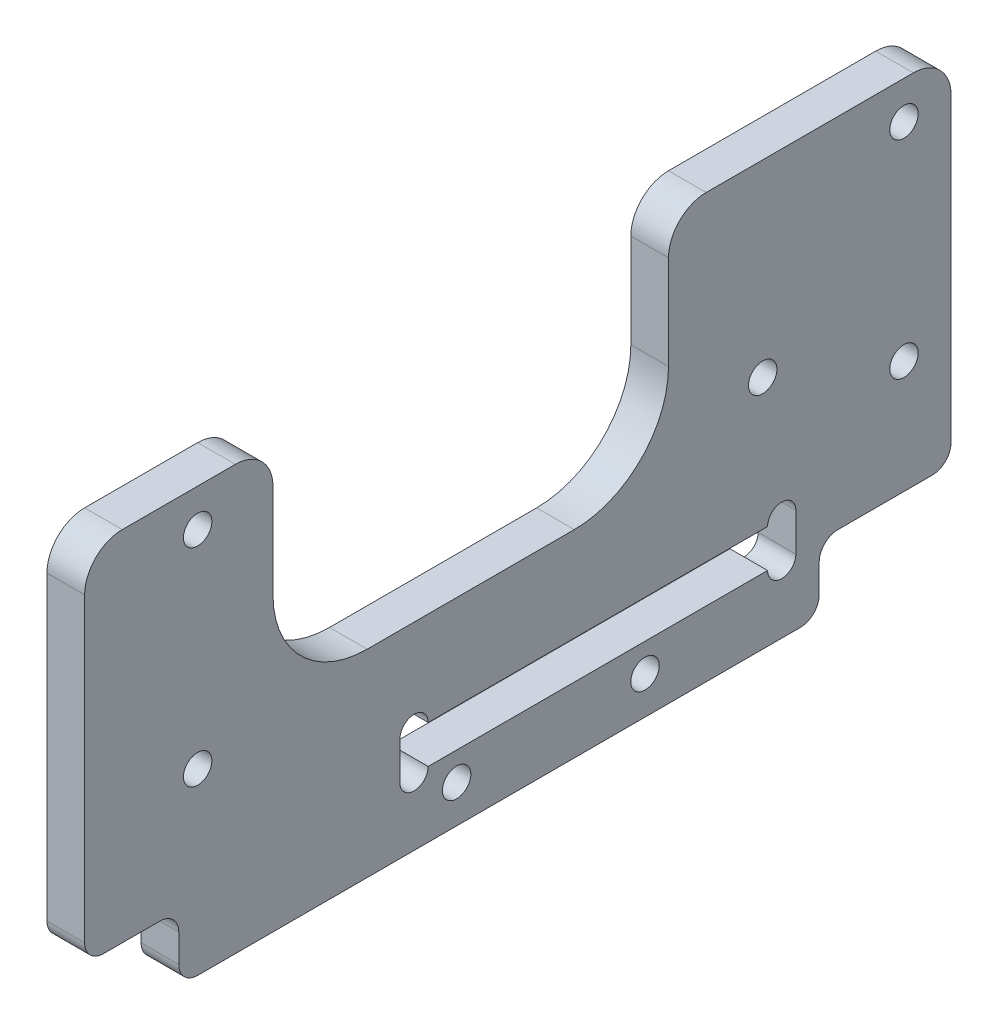
from build123d import *

# Parameters (mm, degrees)
SKETCH_1_W              = 85
SKETCH_1_H              = 40
EXTRUDE_1_DEPTH         = 4
SKETCH_2_R              = 1.51
CUT_EXTRUDE_1_DEPTH     = 10
SKETCH_3_R              = 1.51
CUT_EXTRUDE_2_DEPTH     = 10
SKETCH_5_R              = 1.51
CUT_EXTRUDE_4_DEPTH     = 10
SKETCH_6_W              = 85
SKETCH_6_H              = 25
EXTRUDE_2_DEPTH         = 4
SKETCH_7_R              = 1.51
CUT_EXTRUDE_5_DEPTH     = 3
CUT_EXTRUDE_START       = -3
SKETCH_8_R              = 1.51
CUT_EXTRUDE_6_DEPTH     = 3
CUT_EXTRUDE_7_DEPTH     = 10
SKETCH_10_R             = 1.5
CUT_EXTRUDE_8_DEPTH     = 10
SKETCH_12_OUTSIDE_W     = 108.416
SKETCH_12_OUTSIDE_H     = 88.416
CUT_EXTRUDE_9_DEPTH     = 10
SKETCH_13_W             = 85
SKETCH_13_H             = 20
CUT_EXTRUDE_10_DEPTH    = 10
FILLET_2_R              = 4
MOVE_FACE_1_DEPTH       = 4
MOVE_FACE_2_OUTLINE_R   = 1.51
MOVE_FACE_2_DEPTH       = 4
MOVE_FACE_2_2_OUTLINE_R = 1.51
MOVE_FACE_2_2_DEPTH     = 4
MOVE_FACE_3_OUTLINE_R   = 1.51
MOVE_FACE_3_DEPTH       = 4
MOVE_FACE_3_2_OUTLINE_R = 1.51
MOVE_FACE_3_2_DEPTH     = 4
CUT_EXTRUDE_11_DEPTH    = 10
FILLET_3_R              = 2
CUT_EXTRUDE_12_DEPTH    = 10
FILLET_4_R              = 2


# Read off the part's stored shape, not the designer's step: 移动面1, 移动面2, 移动面3
with BuildPart() as part:
    # 草图1 → 凸台-拉伸1 (new body)
    with BuildSketch(Plane(origin=(0, 0, 0), x_dir=(0, 0, -1), z_dir=(1, 0, 0))):
        Rectangle(SKETCH_1_W, SKETCH_1_H)
    extrude(amount=EXTRUDE_1_DEPTH)

    # 草图2 → 切除-拉伸1 (cut)
    with BuildSketch(Plane.ZY):
        with Locations((-37.5, -11)):
            Circle(SKETCH_2_R)
        with Locations((37.5, -11)):
            Circle(SKETCH_2_R)
        with Locations((37.5, 11)):
            Circle(SKETCH_2_R)
        with Locations((-37.5, 11)):
            Circle(SKETCH_2_R)
    extrude(amount=-CUT_EXTRUDE_1_DEPTH, mode=Mode.SUBTRACT)

    # 草图3 → 切除-拉伸2 (cut)
    with BuildSketch(Plane.ZY):
        with Locations((-2.5, 0)):
            Circle(SKETCH_3_R)
        with Locations((-22.5, 0)):
            Circle(SKETCH_3_R)
    extrude(amount=-CUT_EXTRUDE_2_DEPTH, mode=Mode.SUBTRACT)

    # 草图5 → 切除-拉伸4 (cut)
    with BuildSketch(Plane.ZY):
        with BuildLine():
            Line((29.5, 6), (29.5, 20))
            Line((29.5, 20), (-12.5, 20))
            Line((-12.5, 20), (-12.5, 6))
            ThreePointArc((-12.5, 6), (-9.571067812, -1.071067812), (-2.5, -4))
            Line((-2.5, -4), (19.5, -4))
            ThreePointArc((19.5, -4), (26.571067812, -1.071067812), (29.5, 6))
        make_face()
        with Locations((-2.5, 0)):
            Circle(SKETCH_5_R, mode=Mode.SUBTRACT)
    extrude(amount=-CUT_EXTRUDE_4_DEPTH, mode=Mode.SUBTRACT)

    # 草图6 → 凸台-拉伸2 (add)
    with BuildSketch(Plane.ZY):
        with Locations((0, -32.5)):
            Rectangle(SKETCH_6_W, SKETCH_6_H)
    extrude(amount=-EXTRUDE_2_DEPTH)

    # 草图7 → 切除-拉伸5 (cut)
    with BuildSketch(Plane(origin=(4, 0, 0), x_dir=(0, 0, -1), z_dir=(1, 0, 0))):
        with Locations((-10, -11)):
            Circle(SKETCH_7_R)
        with Locations((10, -11)):
            Circle(SKETCH_7_R)
    extrude(amount=-CUT_EXTRUDE_5_DEPTH, mode=Mode.SUBTRACT)

    # 草图8 → 切除-拉伸6 (cut)
    with BuildSketch(Plane.ZY.offset(CUT_EXTRUDE_START)):
        with Locations(Location((-10, -11, 0), (0, 0, 180))):
            Circle(SKETCH_8_R)
        with Locations(Location((10, -11, 0), (0, 0, 180))):
            Circle(SKETCH_8_R)
    extrude(amount=CUT_EXTRUDE_6_DEPTH, mode=Mode.SUBTRACT)

    # 草图9 → 切除-拉伸7 (cut)
    with BuildSketch(Plane(origin=(4, 0, 0), x_dir=(0, 0, -1), z_dir=(1, 0, 0))):
        Polygon((26, -14), (17.872575328, -14), (-2.448990482, -14), (-16, -14), (-16, -18), (-14, -18), (24, -18), (26, -18), align=None)
    extrude(amount=-CUT_EXTRUDE_7_DEPTH, mode=Mode.SUBTRACT)

    # 草图10 → 切除-拉伸8 (cut)
    with BuildSketch(Plane(origin=(4, 0, 0), x_dir=(0, 0, -1), z_dir=(1, 0, 0))):
        with Locations((24.52, -18.02)):
            Circle(SKETCH_10_R)
        with Locations((-14.52, -18.02)):
            Circle(SKETCH_10_R)
        with Locations((-14.52, -13.98)):
            Circle(SKETCH_10_R)
        with Locations((24.52, -13.98)):
            Circle(SKETCH_10_R)
        Polygon((26.02, -13.98), (17.872575328, -13.98), (-2.448990482, -13.98), (-16.02, -13.98), (-16.02, -18.02), (-14, -18.02), (24, -18.02), (26.02, -18.02), align=None)
    extrude(amount=-CUT_EXTRUDE_8_DEPTH, mode=Mode.SUBTRACT)

    # 草图12 outside → 切除-拉伸9 (cut)
    with BuildSketch(Plane.ZY):
        with Locations((0, -12.5)):
            Rectangle(SKETCH_12_OUTSIDE_W, SKETCH_12_OUTSIDE_H)
        with BuildLine():
            Line((-12.5, 6), (-12.5, 16))
            ThreePointArc((-12.5, 16), (-13.671572875, 18.828427125), (-16.5, 20))
            Line((-16.5, 20), (-38.5, 20))
            ThreePointArc((-38.5, 20), (-41.328427125, 18.828427125), (-42.5, 16))
            Line((-42.5, 16), (-42.5, -45))
            Line((-42.5, -45), (42.5, -45))
            Line((42.5, -45), (42.5, 16))
            ThreePointArc((42.5, 16), (41.328427125, 18.828427125), (38.5, 20))
            Line((38.5, 20), (33.5, 20))
            ThreePointArc((33.5, 20), (30.671572875, 18.828427125), (29.5, 16))
            Line((29.5, 16), (29.5, 6))
            ThreePointArc((29.5, 6), (26.571067812, -1.071067812), (19.5, -4))
            Line((19.5, -4), (-2.5, -4))
            ThreePointArc((-2.5, -4), (-9.571067812, -1.071067812), (-12.5, 6))
        make_face(mode=Mode.SUBTRACT)
    extrude(amount=-CUT_EXTRUDE_9_DEPTH, mode=Mode.SUBTRACT)

    # 草图13 → 切除-拉伸10 (cut)
    with BuildSketch(Plane.ZY):
        with Locations((0, -35)):
            Rectangle(SKETCH_13_W, SKETCH_13_H)
    extrude(amount=-CUT_EXTRUDE_10_DEPTH, mode=Mode.SUBTRACT)

    # 圆角2
    fillet_2_edges = [part.edges().sort_by_distance(p)[0] for p in [
        (2, -25, 42.5),
        (2, -25, -42.5),
    ]]
    fillet(fillet_2_edges, radius=FILLET_2_R)

    # Move Face 1 outline → Move Face 1 (add)
    with BuildSketch(Plane.YZ):
        with BuildLine():
            Line((20, 38.5), (20, 45.5))
            ThreePointArc((20, 45.5), (18.828427125, 48.328427125), (16, 49.5))
            Line((16, 49.5), (-21, 49.5))
            ThreePointArc((-21, 49.5), (-23.828427125, 48.328427125), (-25, 45.5))
            Line((-25, 45.5), (-25, 38.5))
            ThreePointArc((-25, 38.5), (-23.828427125, 41.328427125), (-21, 42.5))
            Line((-21, 42.5), (16, 42.5))
            ThreePointArc((16, 42.5), (18.828427125, 41.328427125), (20, 38.5))
        make_face()
    extrude(amount=MOVE_FACE_1_DEPTH)

    # Move Face 2 outline → Move Face 2 (cut)
    with BuildSketch(Plane.YZ):
        with Locations((-21, -10)):
            Circle(MOVE_FACE_2_OUTLINE_R)
        with Locations((-21, 10)):
            Circle(MOVE_FACE_2_OUTLINE_R)
    extrude(amount=MOVE_FACE_2_DEPTH, mode=Mode.SUBTRACT)

    # Move Face 2 2 outline → Move Face 2 2 (add)
    with BuildSketch(Plane.YZ):
        with Locations((-11, -10)):
            Circle(MOVE_FACE_2_2_OUTLINE_R)
        with Locations((-11, 10)):
            Circle(MOVE_FACE_2_2_OUTLINE_R)
    extrude(amount=MOVE_FACE_2_2_DEPTH)

    # Move Face 3 outline → Move Face 3 (cut)
    with BuildSketch(Plane.YZ):
        with Locations((-6, -37.5)):
            Circle(MOVE_FACE_3_OUTLINE_R)
        with Locations((-6, 37.5)):
            Circle(MOVE_FACE_3_OUTLINE_R)
        with Locations((16, 37.5)):
            Circle(MOVE_FACE_3_OUTLINE_R)
        with Locations((16, -37.5)):
            Circle(MOVE_FACE_3_OUTLINE_R)
    extrude(amount=MOVE_FACE_3_DEPTH, mode=Mode.SUBTRACT)

    # Move Face 3 2 outline → Move Face 3 2 (add)
    with BuildSketch(Plane.YZ):
        with Locations((-11, -37.5)):
            Circle(MOVE_FACE_3_2_OUTLINE_R)
        with Locations((-11, 37.5)):
            Circle(MOVE_FACE_3_2_OUTLINE_R)
        with Locations((11, 37.5)):
            Circle(MOVE_FACE_3_2_OUTLINE_R)
        with Locations((11, -37.5)):
            Circle(MOVE_FACE_3_2_OUTLINE_R)
    extrude(amount=MOVE_FACE_3_2_DEPTH)

    # 草图14 → 切除-拉伸11 (cut)
    with BuildSketch(Plane(origin=(4, 0, 0), x_dir=(0, 0, -1), z_dir=(1, 0, 0))):
        with BuildLine():
            Line((42.5, -21), (42.5, -18))
            Line((42.5, -18), (28.5, -18))
            Line((28.5, -18), (28.5, -25))
            Line((28.5, -25), (38.5, -25))
            ThreePointArc((38.5, -25), (41.328427125, -23.828427125), (42.5, -21))
        make_face()
    extrude(amount=-CUT_EXTRUDE_11_DEPTH, mode=Mode.SUBTRACT)

    # 圆角3
    fillet_3_edges = [part.edges().sort_by_distance(p)[0] for p in [
        (2, -18, -28.5),
        (2, -25, -28.5),
        (2, -18, -42.5),
    ]]
    fillet(fillet_3_edges, radius=FILLET_3_R)

    # 草图16 → 切除-拉伸12 (cut)
    with BuildSketch(Plane.ZY):
        with BuildLine():
            Line((49.5, -18), (39.5, -18))
            Line((39.5, -18), (39.5, -25))
            Line((39.5, -25), (45.5, -25))
            ThreePointArc((45.5, -25), (48.328427125, -23.828427125), (49.5, -21))
            Line((49.5, -21), (49.5, -18))
        make_face()
    extrude(amount=-CUT_EXTRUDE_12_DEPTH, mode=Mode.SUBTRACT)

    # 圆角4
    fillet_4_edges = [part.edges().sort_by_distance(p)[0] for p in [
        (2, -18, 39.5),
        (2, -18, 49.5),
        (2, -25, 39.5),
    ]]
    fillet(fillet_4_edges, radius=FILLET_4_R)


solid = part.part
